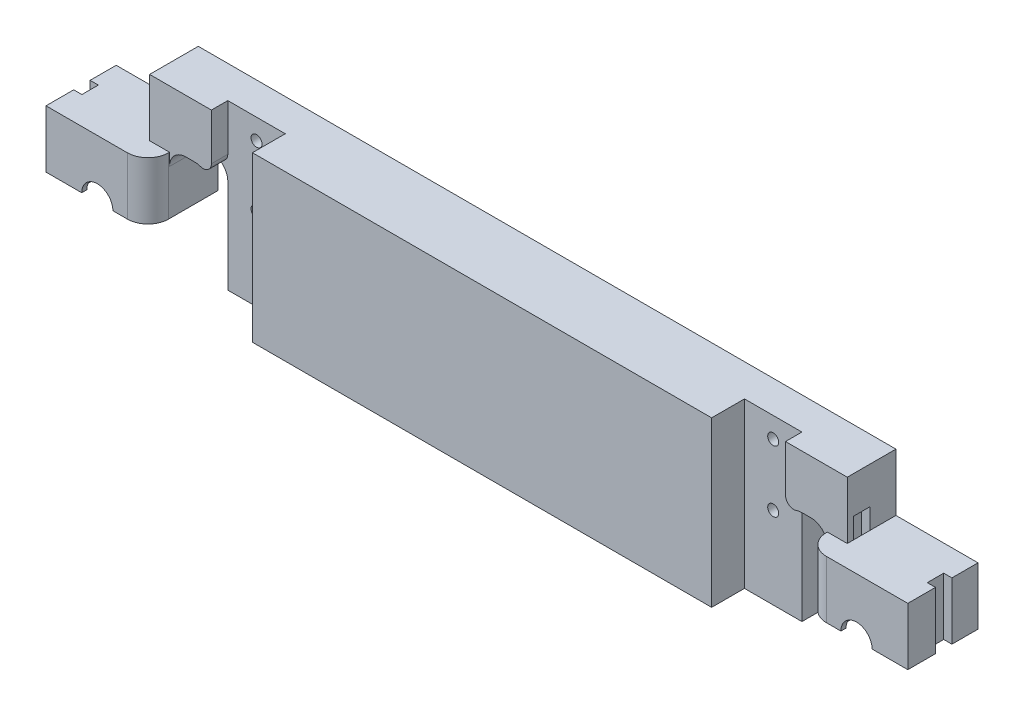
from build123d import *

# Parameters (mm, degrees)
BOSS_EXTRUDE1_DEPTH      = 9.525
BOSS_EXTRUDE1_DEPTH_BACK = 9.525
SKETCH1_R                = 1.7
CUT_EXTRUDE1_DEPTH       = 6.35
CUT_EXTRUDE1_DEPTH_BACK  = 27.686
SKETCH2_W                = 2.54
SKETCH2_H                = 5.08
BOSS_EXTRUDE2_DEPTH      = 1.5875
BOSS_EXTRUDE3_START      = 1.5875
SKETCH5_R                = 1.7
BOSS_EXTRUDE3_DEPTH      = 1.5875
CUT_EXTRUDE2_START       = -5.08
CUT_EXTRUDE2_DEPTH       = 5.08
FILLET1_R                = 6.35
FILLET2_R                = 2.54
CHAMFER1_SIZE            = 0.5
SKETCH8_W                = 17.78
SKETCH8_H                = 50.8
CUT_EXTRUDE3_DEPTH       = 5.08
FILLET3_START            = -0.635
FILLET3_DEPTH            = 5.635


with BuildPart() as part:
    # Sketch1 → Boss-Extrude1 (new, two sides: drawn at the far end of the back side and taken through both)
    with BuildSketch(Plane.XY.offset(-BOSS_EXTRUDE1_DEPTH_BACK)):
        with BuildLine():
            Line((-107.95, 0), (-133.35, 0))
            Line((-133.35, 0), (-133.35, -17.78))
            Line((-133.35, -17.78), (-123.825, -17.78))
            ThreePointArc((-123.825, -17.78), (-117.475, -11.43), (-111.125, -17.78))
            Line((-111.125, -17.78), (-101.7905, -17.78))
            Line((-101.7905, -17.78), (-101.7905, -3.81))
            ThreePointArc((-101.7905, -3.81), (-100.302602448, -0.217897552), (-96.7105, 1.27))
            Line((-96.7105, 1.27), (-93.9165, 1.27))
            ThreePointArc((-93.9165, 1.27), (-90.324397552, -0.217897552), (-88.8365, -3.81))
            Line((-88.8365, -3.81), (-88.8365, -17.78))
            Line((-88.8365, -17.78), (-88.8365, -33.02))
            Line((-88.8365, -33.02), (88.8365, -33.02))
            Line((88.8365, -33.02), (88.8365, -17.78))
            Line((88.8365, -17.78), (88.8365, -3.81))
            ThreePointArc((88.8365, -3.81), (90.324397552, -0.217897552), (93.9165, 1.27))
            Line((93.9165, 1.27), (96.7105, 1.27))
            ThreePointArc((96.7105, 1.27), (100.302602448, -0.217897552), (101.7905, -3.81))
            Line((101.7905, -3.81), (101.7905, -17.78))
            Line((101.7905, -17.78), (111.125, -17.78))
            ThreePointArc((111.125, -17.78), (117.475, -11.43), (123.825, -17.78))
            Line((123.825, -17.78), (133.35, -17.78))
            Line((133.35, -17.78), (133.35, 0))
            Line((133.35, 0), (107.95, 0))
            Line((107.95, 0), (107.95, 17.78))
            Line((107.95, 17.78), (-107.95, 17.78))
            Line((-107.95, 17.78), (-107.95, 0))
        make_face()
        with Locations((-79.9465, -7.62)):
            Circle(SKETCH1_R, mode=Mode.SUBTRACT)
        with Locations((-79.9465, 11.43)):
            Circle(SKETCH1_R, mode=Mode.SUBTRACT)
        with Locations((79.9465, -7.62)):
            Circle(SKETCH1_R, mode=Mode.SUBTRACT)
        with Locations((79.9465, 11.43)):
            Circle(SKETCH1_R, mode=Mode.SUBTRACT)
    extrude(amount=BOSS_EXTRUDE1_DEPTH + BOSS_EXTRUDE1_DEPTH_BACK)

    # Sketch2 → Cut-Extrude1 (cut, two sides: drawn at the far end of the back side and taken through both)
    with BuildSketch(Plane(origin=(0, 0, 0), x_dir=(1, 0, 0), z_dir=(0, 1, 0)).offset(-CUT_EXTRUDE1_DEPTH_BACK)):
        with Locations((-106.68, 0)):
            Rectangle(SKETCH2_W, SKETCH2_H)
        with Locations((-132.08, 0)):
            Rectangle(SKETCH2_W, SKETCH2_H)
        with Locations((132.08, 0)):
            Rectangle(SKETCH2_W, SKETCH2_H)
        with Locations((106.68, 0)):
            Rectangle(SKETCH2_W, SKETCH2_H)
    extrude(amount=CUT_EXTRUDE1_DEPTH + CUT_EXTRUDE1_DEPTH_BACK, mode=Mode.SUBTRACT)

    # Sketch3 → Boss-Extrude2 (add)
    with BuildSketch(Plane.XY.offset(9.525)):
        with BuildLine():
            Line((-101.7905, -17.78), (-101.7905, 0))
            Line((-101.7905, 0), (-133.35, 0))
            Line((-133.35, 0), (-133.35, -17.78))
            Line((-133.35, -17.78), (-122.301, -17.78))
            ThreePointArc((-122.301, -17.78), (-117.475, -12.954), (-112.649, -17.78))
            Line((-112.649, -17.78), (-101.7905, -17.78))
        make_face()
        with BuildLine():
            Line((101.7905, -17.78), (112.649, -17.78))
            ThreePointArc((112.649, -17.78), (117.475, -12.954), (122.301, -17.78))
            Line((122.301, -17.78), (133.35, -17.78))
            Line((133.35, -17.78), (133.35, 0))
            Line((133.35, 0), (101.7905, 0))
            Line((101.7905, 0), (101.7905, -17.78))
        make_face()
    boss_extrude2 = extrude(amount=BOSS_EXTRUDE2_DEPTH)

    # Mirror1: Boss-Extrude2 across plane
    add(boss_extrude2.mirror(Plane.XY))

    # Sketch5 → Boss-Extrude3 (add)
    with BuildSketch(Plane(origin=(0, 0, -9.525), x_dir=(-1, 0, 0), z_dir=(0, 0, -1)).offset(BOSS_EXTRUDE3_START)):
        with BuildLine():
            Line((-107.95, 0), (-101.7905, 0))
            Line((-101.7905, 0), (-101.7905, -3.81))
            ThreePointArc((-101.7905, -3.81), (-100.302602448, -0.217897552), (-96.7105, 1.27))
            Line((-96.7105, 1.27), (-93.9165, 1.27))
            ThreePointArc((-93.9165, 1.27), (-90.324397552, -0.217897552), (-88.8365, -3.81))
            Line((-88.8365, -3.81), (-88.8365, -33.02))
            Line((-88.8365, -33.02), (88.8365, -33.02))
            Line((88.8365, -33.02), (88.8365, -3.81))
            ThreePointArc((88.8365, -3.81), (90.324397552, -0.217897552), (93.9165, 1.27))
            Line((93.9165, 1.27), (96.7105, 1.27))
            ThreePointArc((96.7105, 1.27), (100.302602448, -0.217897552), (101.7905, -3.81))
            Line((101.7905, -3.81), (101.7905, 0))
            Line((101.7905, 0), (107.95, 0))
            Line((107.95, 0), (107.95, 17.78))
            Line((107.95, 17.78), (-107.95, 17.78))
            Line((-107.95, 17.78), (-107.95, 0))
        make_face()
        with Locations(Location((-79.9465, -7.62, 0), (0, 0, 180))):
            Circle(SKETCH5_R, mode=Mode.SUBTRACT)
        with Locations(Location((-79.9465, 11.43, 0), (0, 0, 180))):
            Circle(SKETCH5_R, mode=Mode.SUBTRACT)
        with Locations(Location((79.9465, -7.62, 0), (0, 0, 180))):
            Circle(SKETCH5_R, mode=Mode.SUBTRACT)
        with Locations(Location((79.9465, 11.43, 0), (0, 0, 180))):
            Circle(SKETCH5_R, mode=Mode.SUBTRACT)
    extrude(amount=-BOSS_EXTRUDE3_DEPTH)

    # Sketch7 → Cut-Extrude2 (cut)
    with BuildSketch(Plane.XY.offset(9.525).offset(CUT_EXTRUDE2_START)):
        with BuildLine():
            Line((-88.8365, -33.02), (-88.8365, -3.81))
            ThreePointArc((-88.8365, -3.81), (-90.324397552, -0.217897552), (-93.9165, 1.27))
            Line((-93.9165, 1.27), (-96.7105, 1.27))
            ThreePointArc((-96.7105, 1.27), (-100.302602448, -0.217897552), (-101.7905, -3.81))
            Line((-101.7905, -3.81), (-101.7905, 0))
            Line((-101.7905, 0), (-107.95, 0))
            Line((-107.95, 0), (-107.95, 17.78))
            Line((-107.95, 17.78), (-71.0565, 17.78))
            Line((-71.0565, 17.78), (-71.0565, -33.02))
            Line((-71.0565, -33.02), (-88.8365, -33.02))
        make_face()
        with BuildLine():
            Line((71.0565, -33.02), (88.8365, -33.02))
            Line((88.8365, -33.02), (88.8365, -3.81))
            ThreePointArc((88.8365, -3.81), (90.324397552, -0.217897552), (93.9165, 1.27))
            Line((93.9165, 1.27), (96.7105, 1.27))
            ThreePointArc((96.7105, 1.27), (100.302602448, -0.217897552), (101.7905, -3.81))
            Line((101.7905, -3.81), (101.7905, 0))
            Line((101.7905, 0), (107.95, 0))
            Line((107.95, 0), (107.95, 17.78))
            Line((107.95, 17.78), (71.0565, 17.78))
            Line((71.0565, 17.78), (71.0565, -33.02))
        make_face()
    extrude(amount=CUT_EXTRUDE2_DEPTH, mode=Mode.SUBTRACT)

    # Fillet1
    fillet1_edges = [part.edges().sort_by_distance(p)[0] for p in [
        (-101.7905, -8.89, 11.1125),
        (101.7905, -8.89, 11.1125),
    ]]
    fillet(fillet1_edges, radius=FILLET1_R)

    # Fillet2
    fillet2_edges = [part.edges().sort_by_distance(p)[0] for p in [
        (105.41, 6.35, 0),
        (-105.41, 6.35, 0),
    ]]
    fillet(fillet2_edges, radius=FILLET2_R - 0.0001)  # a hair under: the kernel refuses the full size

    # Chamfer1
    chamfer1_edges = [part.edges().sort_by_distance(p)[0] for p in [
        (-107.21975, -17.78, -11.1125),
        (-117.475, -12.954, -11.1125),
        (-127.8255, -17.78, -11.1125),
        (-133.35, -8.89, -11.1125),
        (-101.7905, -10.795, -11.1125),
        (117.475, -12.954, -11.1125),
        (107.21975, -17.78, -11.1125),
        (120.65, 0, -11.1125),
        (133.35, -8.89, -11.1125),
        (127.8255, -17.78, -11.1125),
        (101.7905, -10.795, -11.1125),
        (-120.65, 0, -11.1125),
        (-81.6465, -7.62, -11.1125),
        (78.2465, 11.43, -11.1125),
        (78.2465, -7.62, -11.1125),
        (-81.6465, 11.43, -11.1125),
        (0, 17.78, -11.1125),
        (107.95, 8.89, -11.1125),
        (100.302602448, -0.217897552, -11.1125),
        (95.3135, 1.27, -11.1125),
        (90.324397552, -0.217897552, -11.1125),
        (88.8365, -18.415, -11.1125),
        (0, -33.02, -11.1125),
        (-88.8365, -18.415, -11.1125),
        (-90.324397552, -0.217897552, -11.1125),
        (-95.3135, 1.27, -11.1125),
        (-100.302602448, -0.217897552, -11.1125),
        (-107.95, 8.89, -11.1125),
    ]]
    chamfer(chamfer1_edges, length=CHAMFER1_SIZE)

    # Sketch8 → Cut-Extrude3 (cut)
    with BuildSketch(Plane.XY.offset(4.445)):
        with Locations((-79.9465, -7.62)):
            Rectangle(SKETCH8_W, SKETCH8_H)
        with Locations((79.9465, -7.62)):
            Rectangle(SKETCH8_W, SKETCH8_H)
    extrude(amount=-CUT_EXTRUDE3_DEPTH, mode=Mode.SUBTRACT)

    # Fillet3: read off the stored shape, not the designer's step
    # Fillet3 outline → Fillet3 (cut)
    with BuildSketch(Plane.XY.offset(FILLET3_START)):
        with BuildLine():
            ThreePointArc((92.223166667, 0.979469931), (89.910030316, 1.300303581), (88.8365, 3.374204897))
            Line((88.8365, 3.374204897), (88.8365, -3.81))
            ThreePointArc((88.8365, -3.81), (89.768697369, -0.877060633), (92.223166667, 0.979469931))
        make_face()
        with BuildLine():
            ThreePointArc((-88.8365, 3.374204897), (-89.910030316, 1.300303581), (-92.223166667, 0.979469931))
            ThreePointArc((-92.223166667, 0.979469931), (-89.768697369, -0.877060633), (-88.8365, -3.81))
            Line((-88.8365, -3.81), (-88.8365, 3.374204897))
        make_face()
    extrude(amount=FILLET3_DEPTH, mode=Mode.SUBTRACT)


solid = part.part
